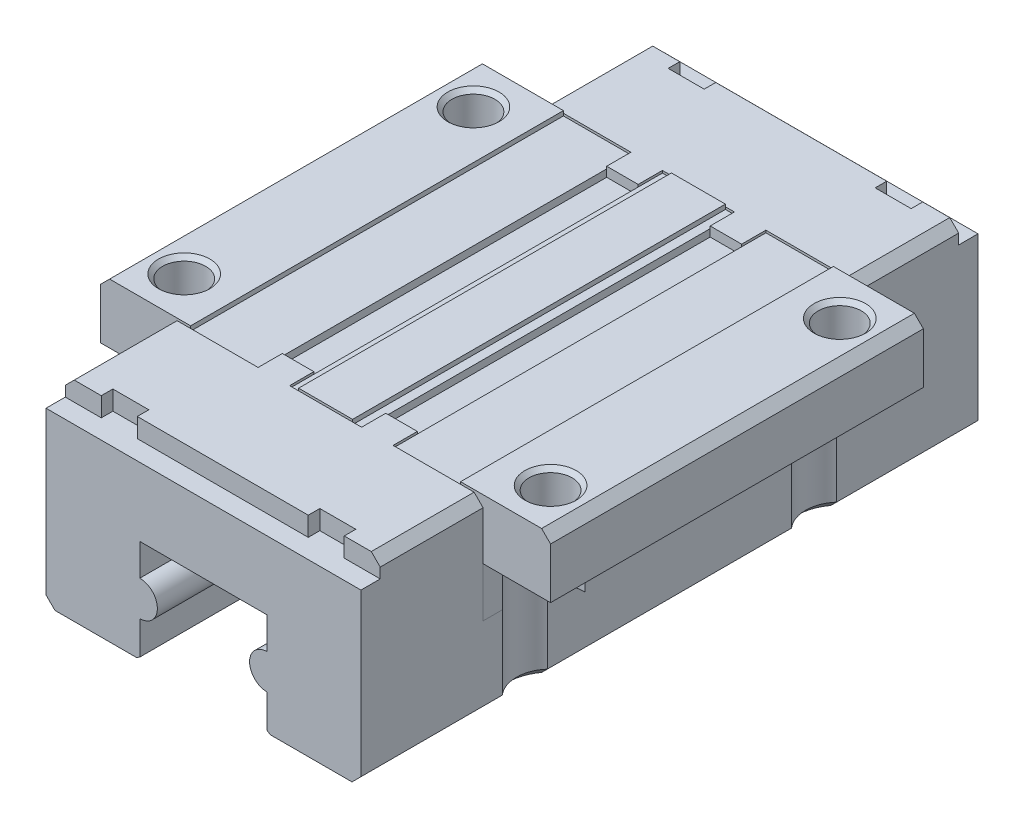
from build123d import *

# Parameters (mm, degrees)
SALIENTE_EXTRUIR1_DEPTH         = 34.36
SALIENTE_EXTRUIR1_START         = 30.682894944
SALIENTE_EXTRUIR1_2_DEPTH       = 0.137105056
SALIENTE_EXTRUIR1_START_2       = 12
SALIENTE_EXTRUIR1_3_DEPTH       = 2.1
SALIENTE_EXTRUIR2_DEPTH         = 0.137105056
SALIENTE_EXTRUIR3_START         = 1.2
SALIENTE_EXTRUIR3_DEPTH         = 1.2
SALIENTE_EXTRUIR4_START         = 1.2
SALIENTE_EXTRUIR4_DEPTH         = 1.2
SALIENTE_EXTRUIR5_DEPTH         = 11.682894944
CORTAR_EXTRUIR1_DEPTH           = 11.82
CORTAR_EXTRUIR2_DEPTH           = 11.82
CORTAR_EXTRUIR3_DEPTH           = 0.137105056
CROQUIS9_W                      = 0.137105056
CROQUIS9_H                      = 7.7
SALIENTE_EXTRUIR6_DEPTH         = 6.5
CORTAR_EXTRUIR4_DEPTH           = 1.2
CROQUIS11_W                     = 0.137105056
CROQUIS11_H                     = 6.5
CORTAR_EXTRUIR5_DEPTH           = 6.5
SALIENTE_EXTRUIR7_START         = 1.2
SALIENTE_EXTRUIR7_DEPTH         = 1.2
CORTAR_EXTRUIR6_DEPTH           = 0.137105056
CROQUIS14_W                     = 0.137105056
CROQUIS14_H                     = 7.7
SALIENTE_EXTRUIR8_DEPTH         = 6.5
CORTAR_EXTRUIR7_DEPTH           = 1.2
CROQUIS16_W                     = 0.137105056
CROQUIS16_H                     = 6.5
CORTAR_EXTRUIR8_DEPTH           = 6.5
SALIENTE_EXTRUIR9_START         = 1.2
SALIENTE_EXTRUIR9_DEPTH         = 1.2
CROQUIS18_W                     = 57
CROQUIS18_H                     = 7.7
SALIENTE_EXTRUIR10_DEPTH        = 30.682894944
CROQUIS19_W                     = 30.82
CROQUIS19_H                     = 7.7
CROQUIS19_W_2                   = 11.82
SALIENTE_EXTRUIR11_DEPTH        = 6.5
CROQUIS20_W                     = 30.82
CROQUIS20_H                     = 7.7
CROQUIS20_W_2                   = 11.82
SALIENTE_EXTRUIR12_DEPTH        = 6.5
CROQUIS21_W                     = 70
CROQUIS21_H                     = 77
SALIENTE_EXTRUIR13_DEPTH        = 8.94
SALIENTE_EXTRUIR14_START        = 12.9
SALIENTE_EXTRUIR14_DEPTH        = 12.9
CORTAR_EXTRUIR9_DEPTH           = 1.2
CORTAR_EXTRUIR10_DEPTH          = 1.2
CORTAR_EXTRUIR11_DEPTH          = 6.5
CORTAR_EXTRUIR12_DEPTH          = 6.5
CORTAR_EXTRUIR13_DEPTH          = 1.2
CORTAR_EXTRUIR14_DEPTH          = 1.2
CORTAR_EXTRUIR15_DEPTH          = 6.5
CORTAR_EXTRUIR16_DEPTH          = 6.5
CROQUIS31_W                     = 19
CROQUIS31_H                     = 29.54
CORTAR_EXTRUIR17_DEPTH          = 10.5
CROQUIS32_W                     = 19
CROQUIS32_H                     = 29.54
CORTAR_EXTRUIR18_DEPTH          = 10.5
CORTAR_EXTRUIR19_DEPTH          = 12.9
CORTAR_EXTRUIR20_DEPTH          = 12.9
CORTAR_EXTRUIR21_DEPTH          = 12.9
CORTAR_EXTRUIR22_DEPTH          = 12.9
CROQUIS37_W                     = 49
CROQUIS37_H                     = 29.54
SALIENTE_EXTRUIR15_DEPTH        = 19
CROQUIS38_W                     = 14
CROQUIS38_H                     = 58
SALIENTE_EXTRUIR16_DEPTH        = 0.36
CROQUIS39_W                     = 14
CROQUIS39_H                     = 58
SALIENTE_EXTRUIR17_DEPTH        = 0.36
CROQUIS40_W                     = 42
CROQUIS40_H                     = 58
CORTAR_EXTRUIR23_DEPTH          = 0.36
CROQUIS41_W                     = 21
CROQUIS41_H                     = 3.77
SALIENTE_EXTRUIR18_DEPTH        = 0.36
CROQUIS42_W                     = 21
CROQUIS42_H                     = 3.77
SALIENTE_EXTRUIR19_DEPTH        = 0.36
CROQUIS43_W                     = 21
CROQUIS43_H                     = 50.46
CORTAR_EXTRUIR24_DEPTH          = 1.135
CROQUIS44_W                     = 3
CROQUIS44_H                     = 2.99
CORTAR_EXTRUIR25_DEPTH          = 117.834327147
CROQUIS45_W                     = 37.8
CROQUIS45_H                     = 1.8
CORTAR_EXTRUIR26_DEPTH          = 2.99
CROQUIS46_W                     = 11.2
CROQUIS46_H                     = 1.135
SALIENTE_EXTRUIR20_DEPTH        = 50.46
CROQUIS47_W                     = 11.2
CROQUIS47_H                     = 0.36
CORTAR_EXTRUIR27_DEPTH          = 3.77
CROQUIS48_W                     = 11.2
CROQUIS48_H                     = 0.36
CORTAR_EXTRUIR28_DEPTH          = 3.77
CROQUIS49_W                     = 3
CROQUIS49_H                     = 2.99
CORTAR_EXTRUIR29_DEPTH          = 117.834327147
CROQUIS50_W                     = 37.8
CROQUIS50_H                     = 1.8
CORTAR_EXTRUIR30_DEPTH          = 2.99
CROQUIS51_W                     = 26.6
CROQUIS51_H                     = 1.8
SALIENTE_EXTRUIR21_DEPTH        = 2.99
CORTAR_EXTRUIR31_DEPTH          = 107.466003964
CROQUIS53_W                     = 26.6
CROQUIS53_H                     = 1.8
SALIENTE_EXTRUIR22_DEPTH        = 2.99
DI_METRO_DE_TALADRO_6_7_6_7_1_D = 6.7
NERVIO1_START                   = -4.2
NERVIO1_OUTLINE_W               = 58
NERVIO1_OUTLINE_H               = 0.72
NERVIO1_DEPTH                   = 8.4
CHAFL_N1_SIZE                   = 0.65
CHAFL_N2_SIZE                   = 1.395
CHAFL_N3_SIZE                   = 0.52742157
CHAFL_N3_SIZE2                  = 0.319626063
CHAFL_N4_SIZE                   = 0.319626063
CHAFL_N4_SIZE2                  = 0.52742157


with BuildPart() as part:
    # Saliente-Extruir1: read off the stored shape, not the designer's step
    # Saliente-Extruir1 outline → Saliente-Extruir1 (new body)
    with BuildSketch(Plane.XY.offset(30.82)):
        Polygon((-27.3, 12.9), (27.3, 12.9), (28.5, 14.1), (35, 20.6), (-35, 20.6), (-28.5, 14.1), align=None)
    extrude(amount=SALIENTE_EXTRUIR1_DEPTH)

    # Saliente-Extruir1 2 outline → Saliente-Extruir1 2 (add)
    with BuildSketch(Plane.XY.offset(SALIENTE_EXTRUIR1_START)):
        Polygon((-27.3, 12.9), (27.3, 12.9), (28.5, 14.1), (35, 20.6), (-35, 20.6), (-28.5, 14.1), align=None)
    extrude(amount=SALIENTE_EXTRUIR1_2_DEPTH)

    # Saliente-Extruir1 3 outline → Saliente-Extruir1 3 (cut)
    with BuildSketch(Plane(origin=(0, 0, 0), x_dir=(1, 0, 0), z_dir=(0, 1, 0)).offset(SALIENTE_EXTRUIR1_START_2)):
        with BuildLine():
            ThreePointArc((27.3, -30.682894944), (27.89609649, -30.785612599), (28.5, -30.82))
            Line((28.5, -30.82), (30, -30.820000002))
            Line((30, -30.820000002), (30, -30.682894944))
            Line((30, -30.682894944), (27.3, -30.682894944))
        make_face()
        with BuildLine():
            ThreePointArc((-28.5, -30.82), (-27.89609649, -30.785612599), (-27.3, -30.682894944))
            Line((-27.3, -30.682894944), (-30, -30.682894944))
            Line((-30, -30.682894944), (-30, -30.820000002))
            Line((-30, -30.820000002), (-28.5, -30.82))
        make_face()
    extrude(amount=SALIENTE_EXTRUIR1_3_DEPTH, mode=Mode.SUBTRACT)

    # Croquis2 → Saliente-Extruir2 (add)
    with BuildSketch(Plane.XY.offset(65.18)):
        Polygon((28.5, 12.9), (27.3, 12.9), (-27.3, 12.9), (-28.5, 12.9), (-28.5, 14.1), (-35, 20.6), (35, 20.6), (28.5, 14.1), align=None)
    extrude(amount=SALIENTE_EXTRUIR2_DEPTH)

    # Croquis3 → Saliente-Extruir3 (add)
    with BuildSketch(Plane.XZ.offset(-14.1).offset(SALIENTE_EXTRUIR3_START)):
        with BuildLine():
            Line((-28.5, 30.682894944), (-28.5, 30.82))
            ThreePointArc((-28.5, 30.82), (-27.89609649, 30.785612599), (-27.3, 30.682894944))
            Line((-27.3, 30.682894944), (-28.5, 30.682894944))
        make_face()
    extrude(amount=-SALIENTE_EXTRUIR3_DEPTH)

    # Croquis4 → Saliente-Extruir4 (add)
    with BuildSketch(Plane.XZ.offset(-14.1).offset(SALIENTE_EXTRUIR4_START)):
        with BuildLine():
            Line((28.5, 30.82), (28.5, 30.682894944))
            Line((28.5, 30.682894944), (27.3, 30.682894944))
            ThreePointArc((27.3, 30.682894944), (27.89609649, 30.785612599), (28.5, 30.82))
        make_face()
    extrude(amount=-SALIENTE_EXTRUIR4_DEPTH)

    # Croquis5 → Saliente-Extruir5 (add)
    with BuildSketch(Plane(origin=(0, 0, 30.682894944), x_dir=(-1, 0, 0), z_dir=(0, 0, -1))):
        Polygon((-35, 20.6), (35, 20.6), (28.5, 14.1), (28.5, 12.9), (-28.5, 12.9), (-28.5, 14.1), align=None)
    extrude(amount=SALIENTE_EXTRUIR5_DEPTH)

    # Croquis6 → Cortar-Extruir1 (cut)
    with BuildSketch(Plane(origin=(0, 0, 19), x_dir=(-1, 0, 0), z_dir=(0, 0, -1))):
        Polygon((28.5, 14.1), (35, 20.6), (28.5, 20.6), align=None)
    extrude(amount=-CORTAR_EXTRUIR1_DEPTH, mode=Mode.SUBTRACT)

    # Croquis7 → Cortar-Extruir2 (cut)
    with BuildSketch(Plane(origin=(0, 0, 19), x_dir=(-1, 0, 0), z_dir=(0, 0, -1))):
        Polygon((-35, 20.6), (-28.5, 14.1), (-28.5, 20.6), align=None)
    extrude(amount=-CORTAR_EXTRUIR2_DEPTH, mode=Mode.SUBTRACT)

    # Croquis8 → Cortar-Extruir3 (cut)
    with BuildSketch(Plane.XY.offset(65.317105056)):
        Polygon((35, 20.6), (28.5, 20.6), (28.5, 14.1), align=None)
    extrude(amount=-CORTAR_EXTRUIR3_DEPTH, mode=Mode.SUBTRACT)

    # Croquis9 → Saliente-Extruir6 (add)
    with BuildSketch(Plane(origin=(28.5, 0, 0), x_dir=(0, 0, -1), z_dir=(1, 0, 0))):
        with Locations((-65.248552528, 16.75)):
            Rectangle(CROQUIS9_W, CROQUIS9_H)
    extrude(amount=SALIENTE_EXTRUIR6_DEPTH)

    # Croquis10 → Cortar-Extruir4 (cut)
    with BuildSketch(Plane.XZ.offset(-12.9)):
        with BuildLine():
            Line((28.5, 65.18), (35, 65.18))
            Line((35, 65.18), (35, 65.317105056))
            Line((35, 65.317105056), (27.3, 65.317105056))
            ThreePointArc((27.3, 65.317105056), (27.89609649, 65.214387401), (28.5, 65.18))
        make_face()
    extrude(amount=-CORTAR_EXTRUIR4_DEPTH, mode=Mode.SUBTRACT)

    # Croquis11 → Cortar-Extruir5 (cut)
    with BuildSketch(Plane(origin=(35, 0, 0), x_dir=(0, 0, -1), z_dir=(1, 0, 0))):
        with Locations((-65.248552528, 17.35)):
            Rectangle(CROQUIS11_W, CROQUIS11_H)
    extrude(amount=-CORTAR_EXTRUIR5_DEPTH, mode=Mode.SUBTRACT)

    # Croquis12 → Saliente-Extruir7 (add)
    with BuildSketch(Plane.XZ.offset(-14.1).offset(SALIENTE_EXTRUIR7_START)):
        with BuildLine():
            Line((28.5, 65.317105056), (28.5, 65.18))
            ThreePointArc((28.5, 65.18), (27.89609649, 65.214387401), (27.3, 65.317105056))
            Line((27.3, 65.317105056), (28.5, 65.317105056))
        make_face()
    extrude(amount=-SALIENTE_EXTRUIR7_DEPTH)

    # Croquis13 → Cortar-Extruir6 (cut)
    with BuildSketch(Plane.XY.offset(65.317105056)):
        Polygon((-28.5, 14.1), (-28.5, 20.6), (-35, 20.6), align=None)
    extrude(amount=-CORTAR_EXTRUIR6_DEPTH, mode=Mode.SUBTRACT)

    # Croquis14 → Saliente-Extruir8 (add)
    with BuildSketch(Plane.ZY.offset(28.5)):
        with Locations((65.248552528, 16.75)):
            Rectangle(CROQUIS14_W, CROQUIS14_H)
    extrude(amount=SALIENTE_EXTRUIR8_DEPTH)

    # Croquis15 → Cortar-Extruir7 (cut)
    with BuildSketch(Plane.XZ.offset(-12.9)):
        with BuildLine():
            Line((-27.3, 65.317105056), (-35, 65.317105056))
            Line((-35, 65.317105056), (-35, 65.18))
            Line((-35, 65.18), (-28.5, 65.18))
            ThreePointArc((-28.5, 65.18), (-27.89609649, 65.214387401), (-27.3, 65.317105056))
        make_face()
    extrude(amount=-CORTAR_EXTRUIR7_DEPTH, mode=Mode.SUBTRACT)

    # Croquis16 → Cortar-Extruir8 (cut)
    with BuildSketch(Plane.ZY.offset(35)):
        with Locations((65.248552528, 17.35)):
            Rectangle(CROQUIS16_W, CROQUIS16_H)
    extrude(amount=-CORTAR_EXTRUIR8_DEPTH, mode=Mode.SUBTRACT)

    # Croquis17 → Saliente-Extruir9 (add)
    with BuildSketch(Plane.XZ.offset(-14.1).offset(SALIENTE_EXTRUIR9_START)):
        with BuildLine():
            Line((-28.5, 65.18), (-28.5, 65.317105056))
            Line((-28.5, 65.317105056), (-27.3, 65.317105056))
            ThreePointArc((-27.3, 65.317105056), (-27.89609649, 65.214387401), (-28.5, 65.18))
        make_face()
    extrude(amount=-SALIENTE_EXTRUIR9_DEPTH)

    # Croquis18 → Saliente-Extruir10 (add)
    with BuildSketch(Plane.XY.offset(65.317105056)):
        with Locations((0, 16.75)):
            Rectangle(CROQUIS18_W, CROQUIS18_H)
    extrude(amount=SALIENTE_EXTRUIR10_DEPTH)

    # Croquis19 → Saliente-Extruir11 (add)
    with BuildSketch(Plane(origin=(28.5, 0, 0), x_dir=(0, 0, -1), z_dir=(1, 0, 0))):
        with Locations((-80.59, 16.75)):
            Rectangle(CROQUIS19_W, CROQUIS19_H)
        with Locations((-24.91, 16.75)):
            Rectangle(CROQUIS19_W_2, CROQUIS19_H)
    extrude(amount=SALIENTE_EXTRUIR11_DEPTH)

    # Croquis20 → Saliente-Extruir12 (add)
    with BuildSketch(Plane.ZY.offset(28.5)):
        with Locations((80.59, 16.75)):
            Rectangle(CROQUIS20_W, CROQUIS20_H)
        with Locations((24.91, 16.75)):
            Rectangle(CROQUIS20_W_2, CROQUIS20_H)
    extrude(amount=SALIENTE_EXTRUIR12_DEPTH)

    # Croquis21 → Saliente-Extruir13 (add)
    with BuildSketch(Plane(origin=(0, 20.6, 0), x_dir=(-1, 0, 0), z_dir=(0, 1, 0))):
        with Locations((0, 57.5)):
            Rectangle(CROQUIS21_W, CROQUIS21_H)
    extrude(amount=SALIENTE_EXTRUIR13_DEPTH)

    # Croquis22 → Saliente-Extruir14 (add)
    with BuildSketch(Plane.XZ.offset(-12.9).offset(SALIENTE_EXTRUIR14_START)):
        with BuildLine():
            Line((24.51, 77), (24.51, 74.018849244))
            ThreePointArc((24.51, 74.018849244), (23.180005388, 70.507571516), (24.5, 66.992522274))
            Line((24.5, 66.992522274), (24.5, 29.007477726))
            ThreePointArc((24.5, 29.007477726), (23.180005388, 25.492428484), (24.51, 21.981150756))
            Line((24.51, 21.981150756), (24.51, 19))
            Line((24.51, 19), (-24.51, 19))
            Line((-24.51, 19), (-24.51, 21.981150756))
            ThreePointArc((-24.51, 21.981150756), (-23.180005388, 25.492428484), (-24.5, 29.007477726))
            Line((-24.5, 29.007477726), (-24.5, 66.992522274))
            ThreePointArc((-24.5, 66.992522274), (-23.180005388, 70.507571516), (-24.51, 74.018849244))
            Line((-24.51, 74.018849244), (-24.51, 77))
            Line((-24.51, 77), (-35, 77))
            Line((-35, 77), (-35, 96))
            Line((-35, 96), (35, 96))
            Line((35, 96), (35, 77))
            Line((35, 77), (24.51, 77))
        make_face()
    extrude(amount=-SALIENTE_EXTRUIR14_DEPTH)

    # Croquis23 → Cortar-Extruir9 (cut)
    with BuildSketch(Plane.XZ.offset(-12.9)):
        with BuildLine():
            Line((28.5, 65.18), (35, 65.18))
            Line((35, 65.18), (35, 77))
            Line((35, 77), (24.51, 77))
            Line((24.51, 77), (24.51, 74.018849244))
            ThreePointArc((24.51, 74.018849244), (23.651150756, 68.311150756), (28.5, 65.18))
        make_face()
    extrude(amount=-CORTAR_EXTRUIR9_DEPTH, mode=Mode.SUBTRACT)

    # Croquis24 → Cortar-Extruir10 (cut)
    with BuildSketch(Plane.XZ.offset(-12.9)):
        with BuildLine():
            Line((-24.51, 74.018849244), (-24.51, 77))
            Line((-24.51, 77), (-35, 77))
            Line((-35, 77), (-35, 65.18))
            Line((-35, 65.18), (-28.5, 65.18))
            ThreePointArc((-28.5, 65.18), (-23.651150756, 68.311150756), (-24.51, 74.018849244))
        make_face()
    extrude(amount=-CORTAR_EXTRUIR10_DEPTH, mode=Mode.SUBTRACT)

    # Croquis25 → Cortar-Extruir11 (cut)
    with BuildSketch(Plane.XZ.offset(-14.1)):
        with BuildLine():
            Line((-24.51, 74.018849244), (-24.51, 77))
            Line((-24.51, 77), (-35, 77))
            Line((-35, 77), (-35, 65.18))
            Line((-35, 65.18), (-28.5, 65.18))
            ThreePointArc((-28.5, 65.18), (-23.651150756, 68.311150756), (-24.51, 74.018849244))
        make_face()
    extrude(amount=-CORTAR_EXTRUIR11_DEPTH, mode=Mode.SUBTRACT)

    # Croquis26 → Cortar-Extruir12 (cut)
    with BuildSketch(Plane.XZ.offset(-14.1)):
        with BuildLine():
            Line((28.5, 65.18), (35, 65.18))
            Line((35, 65.18), (35, 77))
            Line((35, 77), (24.51, 77))
            Line((24.51, 77), (24.51, 74.018849244))
            ThreePointArc((24.51, 74.018849244), (23.651150756, 68.311150756), (28.5, 65.18))
        make_face()
    extrude(amount=-CORTAR_EXTRUIR12_DEPTH, mode=Mode.SUBTRACT)

    # Croquis27 → Cortar-Extruir13 (cut)
    with BuildSketch(Plane.XZ.offset(-12.9)):
        with BuildLine():
            Line((24.51, 21.981150756), (24.51, 19))
            Line((24.51, 19), (35, 19))
            Line((35, 19), (35, 30.82))
            Line((35, 30.82), (28.5, 30.82))
            ThreePointArc((28.5, 30.82), (23.651150756, 27.688849244), (24.51, 21.981150756))
        make_face()
    extrude(amount=-CORTAR_EXTRUIR13_DEPTH, mode=Mode.SUBTRACT)

    # Croquis28 → Cortar-Extruir14 (cut)
    with BuildSketch(Plane.XZ.offset(-12.9)):
        with BuildLine():
            Line((-28.5, 30.82), (-35, 30.82))
            Line((-35, 30.82), (-35, 19))
            Line((-35, 19), (-24.51, 19))
            Line((-24.51, 19), (-24.51, 21.981150756))
            ThreePointArc((-24.51, 21.981150756), (-23.651150756, 27.688849244), (-28.5, 30.82))
        make_face()
    extrude(amount=-CORTAR_EXTRUIR14_DEPTH, mode=Mode.SUBTRACT)

    # Croquis29 → Cortar-Extruir15 (cut)
    with BuildSketch(Plane.XZ.offset(-14.1)):
        with BuildLine():
            Line((-28.5, 30.82), (-35, 30.82))
            Line((-35, 30.82), (-35, 19))
            Line((-35, 19), (-24.51, 19))
            Line((-24.51, 19), (-24.51, 21.981150756))
            ThreePointArc((-24.51, 21.981150756), (-23.651150756, 27.688849244), (-28.5, 30.82))
        make_face()
    extrude(amount=-CORTAR_EXTRUIR15_DEPTH, mode=Mode.SUBTRACT)

    # Croquis30 → Cortar-Extruir16 (cut)
    with BuildSketch(Plane.XZ.offset(-14.1)):
        with BuildLine():
            Line((24.51, 21.981150756), (24.51, 19))
            Line((24.51, 19), (35, 19))
            Line((35, 19), (35, 30.82))
            Line((35, 30.82), (28.5, 30.82))
            ThreePointArc((28.5, 30.82), (23.651150756, 27.688849244), (24.51, 21.981150756))
        make_face()
    extrude(amount=-CORTAR_EXTRUIR16_DEPTH, mode=Mode.SUBTRACT)

    # Croquis31 → Cortar-Extruir17 (cut)
    with BuildSketch(Plane(origin=(35, 0, 0), x_dir=(0, 0, -1), z_dir=(1, 0, 0))):
        with Locations((-86.5, 14.77)):
            Rectangle(CROQUIS31_W, CROQUIS31_H)
    extrude(amount=-CORTAR_EXTRUIR17_DEPTH, mode=Mode.SUBTRACT)

    # Croquis32 → Cortar-Extruir18 (cut)
    with BuildSketch(Plane.ZY.offset(35)):
        with Locations((86.5, 14.77)):
            Rectangle(CROQUIS32_W, CROQUIS32_H)
    extrude(amount=-CORTAR_EXTRUIR18_DEPTH, mode=Mode.SUBTRACT)

    # Croquis33 → Cortar-Extruir19 (cut)
    with BuildSketch(Plane.XZ):
        with BuildLine():
            Line((24.51, 74.018849244), (24.51, 77))
            Line((24.51, 77), (24.5, 77))
            Line((24.5, 77), (24.5, 74.007477726))
            ThreePointArc((24.5, 74.007477726), (24.504995954, 74.013167043), (24.51, 74.018849244))
        make_face()
    extrude(amount=-CORTAR_EXTRUIR19_DEPTH, mode=Mode.SUBTRACT)

    # Croquis34 → Cortar-Extruir20 (cut)
    with BuildSketch(Plane.XZ):
        with BuildLine():
            Line((-24.51, 77), (-24.51, 74.018849244))
            ThreePointArc((-24.51, 74.018849244), (-24.504995954, 74.013167043), (-24.5, 74.007477726))
            Line((-24.5, 74.007477726), (-24.5, 77))
            Line((-24.5, 77), (-24.51, 77))
        make_face()
    extrude(amount=-CORTAR_EXTRUIR20_DEPTH, mode=Mode.SUBTRACT)

    # Croquis35 → Cortar-Extruir21 (cut)
    with BuildSketch(Plane.XZ):
        with BuildLine():
            Line((-24.51, 21.981150756), (-24.51, 19))
            Line((-24.51, 19), (-24.5, 19))
            Line((-24.5, 19), (-24.5, 21.992522274))
            ThreePointArc((-24.5, 21.992522274), (-24.504995954, 21.986832957), (-24.51, 21.981150756))
        make_face()
    extrude(amount=-CORTAR_EXTRUIR21_DEPTH, mode=Mode.SUBTRACT)

    # Croquis36 → Cortar-Extruir22 (cut)
    with BuildSketch(Plane.XZ):
        with BuildLine():
            Line((24.51, 19), (24.51, 21.981150756))
            ThreePointArc((24.51, 21.981150756), (24.504995954, 21.986832957), (24.5, 21.992522274))
            Line((24.5, 21.992522274), (24.5, 19))
            Line((24.5, 19), (24.51, 19))
        make_face()
    extrude(amount=-CORTAR_EXTRUIR22_DEPTH, mode=Mode.SUBTRACT)

    # Croquis37 → Saliente-Extruir15 (add)
    with BuildSketch(Plane(origin=(0, 0, 19), x_dir=(-1, 0, 0), z_dir=(0, 0, -1))):
        with Locations((0, 14.77)):
            Rectangle(CROQUIS37_W, CROQUIS37_H)
    extrude(amount=SALIENTE_EXTRUIR15_DEPTH)

    # Croquis38 → Saliente-Extruir16 (add)
    with BuildSketch(Plane(origin=(0, 29.54, 0), x_dir=(-1, 0, 0), z_dir=(0, 1, 0))):
        with Locations((28, 48)):
            Rectangle(CROQUIS38_W, CROQUIS38_H)
    extrude(amount=SALIENTE_EXTRUIR16_DEPTH)

    # Croquis39 → Saliente-Extruir17 (add)
    with BuildSketch(Plane(origin=(0, 29.54, 0), x_dir=(-1, 0, 0), z_dir=(0, 1, 0))):
        with Locations((-28, 48)):
            Rectangle(CROQUIS39_W, CROQUIS39_H)
    extrude(amount=SALIENTE_EXTRUIR17_DEPTH)

    # Croquis40 → Cortar-Extruir23 (cut)
    with BuildSketch(Plane(origin=(0, 29.54, 0), x_dir=(-1, 0, 0), z_dir=(0, 1, 0))):
        with Locations((0, 48)):
            Rectangle(CROQUIS40_W, CROQUIS40_H)
    extrude(amount=-CORTAR_EXTRUIR23_DEPTH, mode=Mode.SUBTRACT)

    # Croquis41 → Saliente-Extruir18 (add)
    with BuildSketch(Plane(origin=(0, 29.18, 0), x_dir=(-1, 0, 0), z_dir=(0, 1, 0))):
        with Locations((0, 75.115)):
            Rectangle(CROQUIS41_W, CROQUIS41_H)
    extrude(amount=SALIENTE_EXTRUIR18_DEPTH)

    # Croquis42 → Saliente-Extruir19 (add)
    with BuildSketch(Plane(origin=(0, 29.18, 0), x_dir=(-1, 0, 0), z_dir=(0, 1, 0))):
        with Locations((0, 20.885)):
            Rectangle(CROQUIS42_W, CROQUIS42_H)
    extrude(amount=SALIENTE_EXTRUIR19_DEPTH)

    # Croquis43 → Cortar-Extruir24 (cut)
    with BuildSketch(Plane(origin=(0, 29.18, 0), x_dir=(-1, 0, 0), z_dir=(0, 1, 0))):
        with Locations((0, 48)):
            Rectangle(CROQUIS43_W, CROQUIS43_H)
    extrude(amount=-CORTAR_EXTRUIR24_DEPTH, mode=Mode.SUBTRACT)

    # Croquis44 → Cortar-Extruir25 (cut, through all)
    with BuildSketch(Plane.ZY.offset(24.5)):
        with Locations((94.5, 28.045)):
            Rectangle(CROQUIS44_W, CROQUIS44_H)
    extrude(amount=-CORTAR_EXTRUIR25_DEPTH, mode=Mode.SUBTRACT)

    # Croquis45 → Cortar-Extruir26 (cut)
    with BuildSketch(Plane(origin=(0, 29.54, 0), x_dir=(-1, 0, 0), z_dir=(0, 1, 0))):
        with Locations((0, 92.1)):
            Rectangle(CROQUIS45_W, CROQUIS45_H)
    extrude(amount=-CORTAR_EXTRUIR26_DEPTH, mode=Mode.SUBTRACT)

    # Croquis46 → Saliente-Extruir20 (add)
    with BuildSketch(Plane(origin=(0, 0, 73.23), x_dir=(-1, 0, 0), z_dir=(0, 0, -1))):
        with Locations((0, 28.6125)):
            Rectangle(CROQUIS46_W, CROQUIS46_H)
    extrude(amount=SALIENTE_EXTRUIR20_DEPTH)

    # Croquis47 → Cortar-Extruir27 (cut)
    with BuildSketch(Plane(origin=(0, 0, 73.23), x_dir=(-1, 0, 0), z_dir=(0, 0, -1))):
        with Locations((0, 29.36)):
            Rectangle(CROQUIS47_W, CROQUIS47_H)
    extrude(amount=-CORTAR_EXTRUIR27_DEPTH, mode=Mode.SUBTRACT)

    # Croquis48 → Cortar-Extruir28 (cut)
    with BuildSketch(Plane.XY.offset(22.77)):
        with Locations((0, 29.36)):
            Rectangle(CROQUIS48_W, CROQUIS48_H)
    extrude(amount=-CORTAR_EXTRUIR28_DEPTH, mode=Mode.SUBTRACT)

    # Croquis49 → Cortar-Extruir29 (cut, through all)
    with BuildSketch(Plane(origin=(24.5, 0, 0), x_dir=(0, 0, -1), z_dir=(1, 0, 0))):
        with Locations((-1.5, 28.045)):
            Rectangle(CROQUIS49_W, CROQUIS49_H)
    extrude(amount=-CORTAR_EXTRUIR29_DEPTH, mode=Mode.SUBTRACT)

    # Croquis50 → Cortar-Extruir30 (cut)
    with BuildSketch(Plane(origin=(0, 29.54, 0), x_dir=(-1, 0, 0), z_dir=(0, 1, 0))):
        with Locations((0, 3.9)):
            Rectangle(CROQUIS50_W, CROQUIS50_H)
    extrude(amount=-CORTAR_EXTRUIR30_DEPTH, mode=Mode.SUBTRACT)

    # Croquis51 → Saliente-Extruir21 (add)
    with BuildSketch(Plane(origin=(0, 26.55, 0), x_dir=(-1, 0, 0), z_dir=(0, 1, 0))):
        with Locations((0, 3.9)):
            Rectangle(CROQUIS51_W, CROQUIS51_H)
    extrude(amount=SALIENTE_EXTRUIR21_DEPTH)

    # Croquis52 → Cortar-Extruir31 (cut, through all)
    with BuildSketch(Plane.XY.offset(96)):
        with BuildLine():
            Line((-9.9, 0), (9.9, 0))
            Line((9.9, 0), (9.9, 5.5))
            ThreePointArc((9.9, 5.5), (7.175, 8.225), (9.9, 10.95))
            Line((9.9, 10.95), (9.9, 15.9))
            Line((9.9, 15.9), (-9.9, 15.9))
            Line((-9.9, 15.9), (-9.9, 10.95))
            ThreePointArc((-9.9, 10.95), (-7.175, 8.225), (-9.9, 5.5))
            Line((-9.9, 5.5), (-9.9, 0))
        make_face()
    extrude(amount=-CORTAR_EXTRUIR31_DEPTH, mode=Mode.SUBTRACT)

    # Croquis53 → Saliente-Extruir22 (add)
    with BuildSketch(Plane(origin=(0, 26.55, 0), x_dir=(-1, 0, 0), z_dir=(0, 1, 0))):
        with Locations((0, 92.1)):
            Rectangle(CROQUIS53_W, CROQUIS53_H)
    extrude(amount=SALIENTE_EXTRUIR22_DEPTH)

    # Diámetro de taladro Ø6.7 (6.7)1 (through all)
    with Locations(Plane(origin=(0, 20.6, 0), x_dir=(-1, 0, 0), z_dir=(0, -1, 0))):
        with Locations((-28.5, -25.5), (-28.5, -70.5), (28.5, -25.5), (28.5, -70.5)):
            Hole(DI_METRO_DE_TALADRO_6_7_6_7_1_D / 2)

    # Nervio1: read off the stored shape, not the designer's step
    # Nervio1 outline → Nervio1 (add)
    with BuildSketch(Plane(origin=(0, 0, 0), x_dir=(0, 0, -1), z_dir=(1, 0, 0)).offset(NERVIO1_START)):
        with Locations((-48, 29.54)):
            Rectangle(NERVIO1_OUTLINE_W, NERVIO1_OUTLINE_H)
    extrude(amount=NERVIO1_DEPTH)

    # Chaflán1
    chafl_n1_edges = [part.edges().sort_by_distance(p)[0] for p in [
        (-31.85, 20.6, 70.5),
        (-31.85, 29.9, 70.5),
        (-31.85, 20.6, 25.5),
        (-31.85, 29.9, 25.5),
        (25.15, 20.6, 70.5),
        (25.15, 29.9, 70.5),
        (25.15, 20.6, 25.5),
        (25.15, 29.9, 25.5),
    ]]
    chamfer(chafl_n1_edges, length=CHAFL_N1_SIZE)

    # Chaflán2
    chafl_n2_edges = [part.edges().sort_by_distance(p)[0] for p in [
        (-24.5, 0, 48),
        (-23.18, 0, 25.5),
        (24.5, 0, 48),
        (23.18, 0, 70.5),
        (24.5, 29.54, 85),
        (24.5, 0, 85.003738863),
        (-24.5, 0, 85.003738863),
        (-23.18, 0, 70.5),
        (-24.5, 0, 10.996261137),
        (23.18, 0, 25.5),
        (24.5, 0, 10.996261137),
        (-35, 29.9, 48),
        (35, 29.9, 48),
        (-24.5, 29.54, 85),
        (24.5, 29.54, 11),
        (-24.5, 29.54, 11),
    ]]
    chamfer(chafl_n2_edges, length=CHAFL_N2_SIZE)

    # Chaflán3
    chafl_n3_edges = [part.edges().sort_by_distance(p)[0] for p in [
        (-9.9, 0, 48),
    ]]
    chafl_n3_side = [part.faces().sort_by_distance(p)[0] for p in [
        (-16.432878245, 0, 48),
    ]]
    chamfer(chafl_n3_edges, length=CHAFL_N3_SIZE, length2=CHAFL_N3_SIZE2, reference=chafl_n3_side[0])

    # Chaflán4
    chafl_n4_edges = [part.edges().sort_by_distance(p)[0] for p in [
        (9.9, 0, 48),
    ]]
    chafl_n4_side = [part.faces().sort_by_distance(p)[0] for p in [
        (9.9, 2.75, 48),
    ]]
    chamfer(chafl_n4_edges, length=CHAFL_N4_SIZE, length2=CHAFL_N4_SIZE2, reference=chafl_n4_side[0])


solid = part.part
